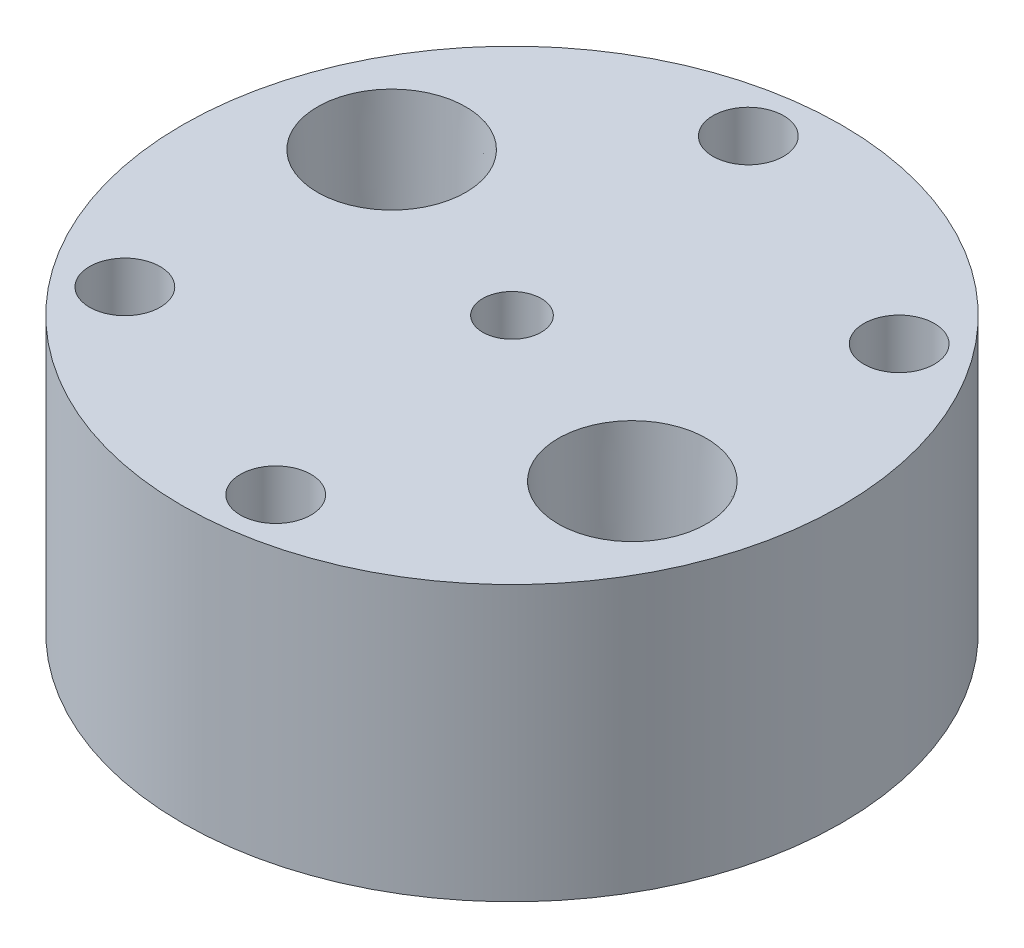
from build123d import *

# Parameters (mm, degrees)
SKETCH1_R                         = 30.48
BOSS_EXTRUDE1_DEPTH               = 25.4
F_1_4_28_TAPPED_HOLE1_D           = 5.4102
SKETCH7_R                         = 11.43
CUT_EXTRUDE2_DEPTH                = 12.7
F_1_4_CLEARANCE_HOLE1_D           = 6.5278
F_1_4_NPT_TAPPED_HOLE1_AT_2_COUNT = 2
F_1_4_NPT_TAPPED_HOLE1_AT_2_PITCH = 40.7035
CUT_EXTRUDE3_DEPTH                = 12.7


with BuildPart() as part:
    # Sketch1 → Boss-Extrude1 (new body)
    with BuildSketch(Plane(origin=(0, 0, 0), x_dir=(1, 0, 0), z_dir=(0, 1, 0))):
        Circle(SKETCH1_R)
    extrude(amount=BOSS_EXTRUDE1_DEPTH)

    # 1/4-28 Tapped Hole1 (through all)
    with Locations(Plane(origin=(0, 25.4, 0), x_dir=(1, 0, 0), z_dir=(0, 1, 0))):
        with Locations((0, 0)):
            Hole(F_1_4_28_TAPPED_HOLE1_D / 2)

    # Sketch7 → Cut-Extrude2 (cut)
    with BuildSketch(Plane.XZ):
        Circle(SKETCH7_R)
    extrude(amount=-CUT_EXTRUDE2_DEPTH, mode=Mode.SUBTRACT)

    # 1/4 Clearance Hole1 (through all)
    with Locations(Plane(origin=(0, 25.4, 0), x_dir=(1, 0, 0), z_dir=(0, 1, 0))):
        with Locations((20.175514493, 15.615257641), (3.435452557, -25.280136906), (-3.435452557, 25.280136906), (-20.175514493, -15.615257641)):
            Hole(F_1_4_CLEARANCE_HOLE1_D / 2)

    # Sketch12 → 1/4 NPT Tapped Hole1 (revolve, cut)
    with BuildSketch(Plane(origin=(-18.83486521, 25.4, -7.709836613), x_dir=(0, 0, 1), z_dir=(1, 0, 0))):
        Polygon((0, 0), (0, 25.4), (5.5626, 25.4), (5.5626, 9.906), (6.557984794, 9.906), (6.8545837, 0), align=None)
    f_1_4_npt_tapped_hole1 = revolve(axis=Axis((-18.83486521, 31.75, -7.709836613), (0, -1, 0)), mode=Mode.SUBTRACT)

    # 1/4 NPT Tapped Hole1 at 2: 1/4 NPT Tapped Hole1 ×2
    with Locations(*[Vector(0.9254666163685309, 0, 0.37882917256645177) * (i * F_1_4_NPT_TAPPED_HOLE1_AT_2_PITCH) for i in range(1, F_1_4_NPT_TAPPED_HOLE1_AT_2_COUNT)]):
        add(f_1_4_npt_tapped_hole1, mode=Mode.SUBTRACT)

    # Sketch13 → Cut-Extrude3 (cut)
    with BuildSketch(Plane.XZ):
        with BuildLine():
            Line((-7.195822597, 8.880598919), (-22.336832207, -3.387945139))
            ThreePointArc((-22.336832207, -3.387945139), (-23.98286581, -9.817111768), (-18.30123054, -13.246780969))
            Line((-18.30123054, -13.246780969), (1.096509596, -11.377282923))
            ThreePointArc((1.096509596, -11.377282923), (4.330017442, -10.578083425), (7.195822597, -8.880598919))
            Line((7.195822597, -8.880598919), (22.336832207, 3.387945139))
            ThreePointArc((22.336832207, 3.387945139), (23.98286581, 9.817111768), (18.30123054, 13.246780969))
            Line((18.30123054, 13.246780969), (-1.096509596, 11.377282923))
            ThreePointArc((-1.096509596, 11.377282923), (-4.330017442, 10.578083425), (-7.195822597, 8.880598919))
        make_face()
    extrude(amount=-CUT_EXTRUDE3_DEPTH, mode=Mode.SUBTRACT)


solid = part.part
